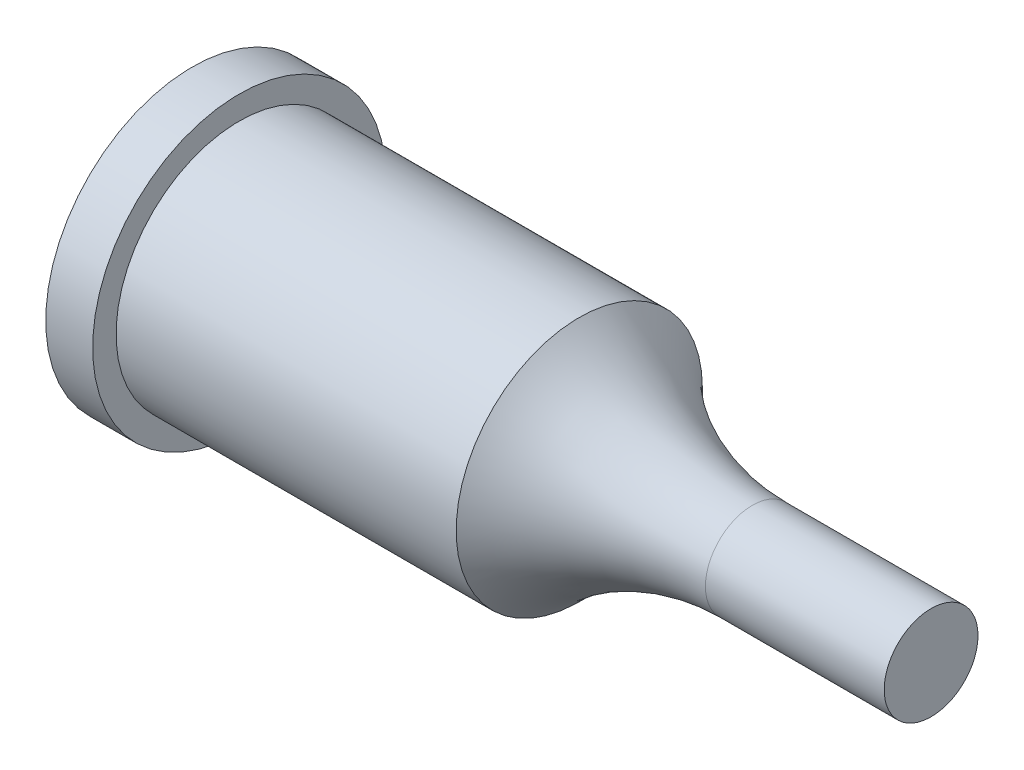
from build123d import *

# Parameters (mm, degrees)
SKETCH_1_W = 15
SKETCH_1_H = 2
FILLET_1_R = 10


with BuildPart() as part:
    # 草图1 → 旋转1 (revolve)
    with BuildSketch(Plane(origin=(0, 0, 0), x_dir=(1, 0, 0), z_dir=(0, 1, 0))):
        Polygon((-22.158783784, -3.392857143), (-20.158783784, -3.392857143), (-20.158783784, 1.857142857), (-20.158783784, 2.857142857), (-22.158783784, 2.857142857), align=None)
        Polygon((-20.158783784, -3.392857143), (-5.658783784, -3.392857143), (-5.658783784, -1.392857143), (-5.658783784, 1.857142857), (-20.158783784, 1.857142857), align=None)
        with Locations((1.841216216, -2.392857143)):
            Rectangle(SKETCH_1_W, SKETCH_1_H)
    revolve(axis=Axis((9.341216216, 0, 3.392857143), (-1, 0, 0)))

    # 圆角1
    # the kernel refuses this fillet: 10 mm, written as the material it adds along each edge
    with BuildSketch(Plane(origin=(-5.658783784, 0, 3.392857143), x_dir=(0, 0, -1), z_dir=(0, 1, 0))) as fillet_1_piece_1:
        with BuildLine():
            CenterArc((12, -7.378177282), FILLET_1_R, 132.454150204, 47.545849796)
            Line((2, -7.378177282), (1.8, -7.378177282))
            Line((1.8, -7.378177282), (1.8, 0))
            Line((1.8, 0), (2, 0.2))
            ThreePointArc((2, 0.2), (3.625, 0.2), (5.115, 0.147563546))
            Line((5.115, 0.147563546), (5.25, 0))
        make_face()
    revolve(axis=Axis((-5.658783784, 0, 3.392857143), (-1, 0, 0)))


solid = part.part
